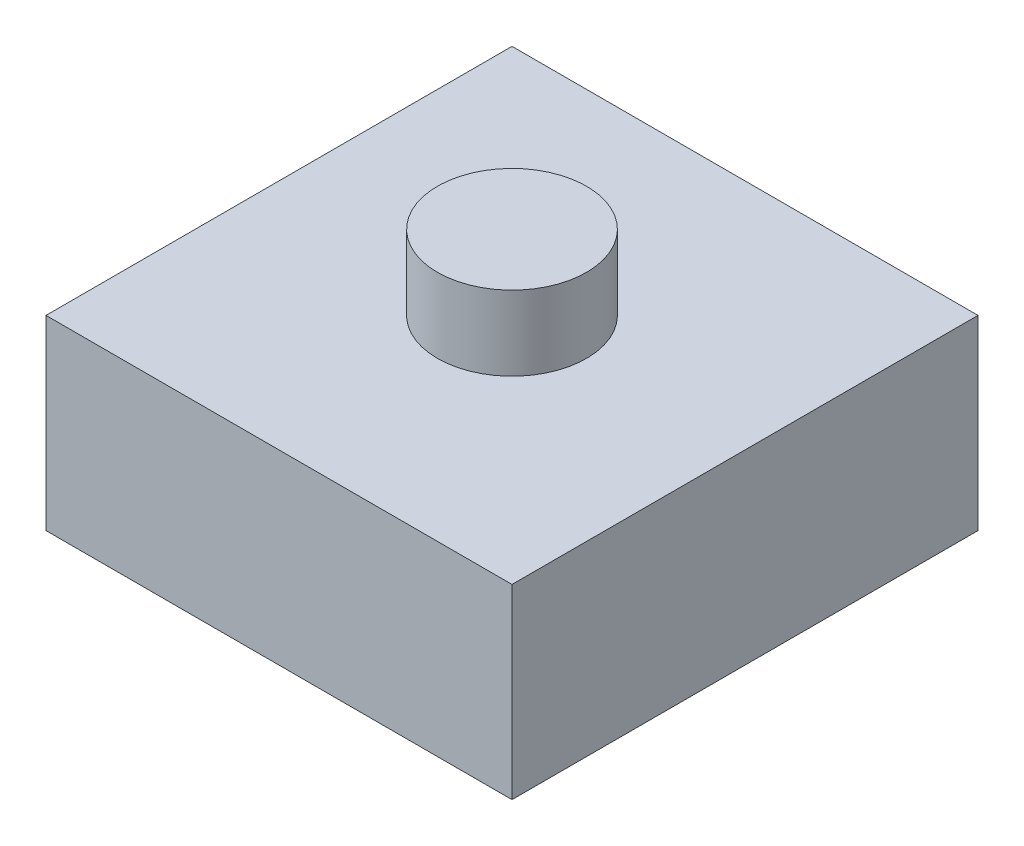
from build123d import *

# Parameters (mm, degrees)
SKETCH1_W           = 25
SKETCH1_H           = 25
BOSS_EXTRUDE1_DEPTH = 10
SKETCH2_R           = 4
BOSS_EXTRUDE2_DEPTH = 4


with BuildPart() as part:
    # Sketch1 → Boss-Extrude1 (new body)
    with BuildSketch(Plane(origin=(0, 0, 0), x_dir=(1, 0, 0), z_dir=(0, 1, 0))):
        Rectangle(SKETCH1_W, SKETCH1_H)
    extrude(amount=BOSS_EXTRUDE1_DEPTH)

    # Sketch2 → Boss-Extrude2 (add)
    with BuildSketch(Plane(origin=(0, 10, 0), x_dir=(1, 0, 0), z_dir=(0, 1, 0))):
        Circle(SKETCH2_R)
    extrude(amount=BOSS_EXTRUDE2_DEPTH)


solid = part.part
